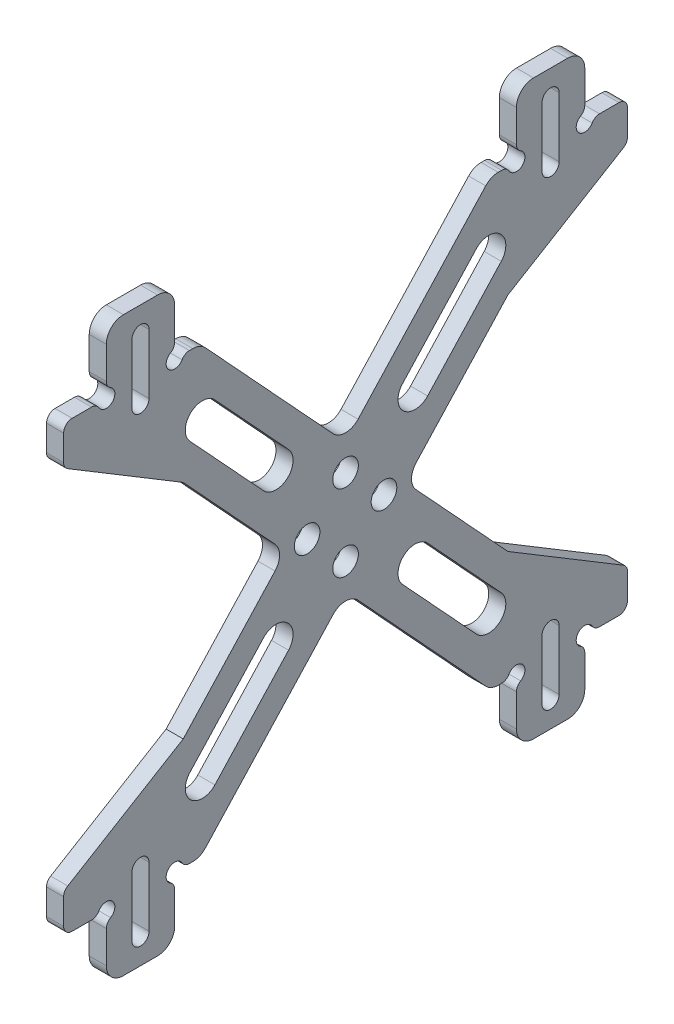
from build123d import *

# Parameters (mm, degrees)
SKETCH_1_W               = 74
SKETCH_1_H               = 52
EXTRUDE_1_DEPTH          = 2
CUT_EXTRUDE_2_DEPTH      = 10
SKETCH_3_W               = 2
SKETCH_3_H               = 8
EXTRUDE_3_DEPTH          = 7.5
FILLET_1_R               = 2
FILLET_1_OF_MIRROR_3_R   = 2
MIRROR_4_DEPTH           = 2
EXTRUDE_4_DEPTH          = 2
FILLET_3_R               = 1
FILLET_4_R               = 2
SKETCH_4_R               = 1.5
CUT_EXTRUDE_3_DEPTH      = 6
SKETCH_5_R               = 1
CUT_EXTRUDE_5_DEPTH      = 6
MIRROR_6_COPY_1_SKETCH_R = 1
MIRROR_6_COPY_1_DEPTH    = 6
SKETCH_6_R               = 1
CUT_EXTRUDE_6_DEPTH      = 10
MIRROR_9_COPY_1_SKETCH_R = 1
MIRROR_9_COPY_1_DEPTH    = 10
FILLET_5_R               = 1
CUT_EXTRUDE_7_DEPTH      = 10
MIRROR_12_COPY_1_DEPTH   = 10


# Read off the part's stored shape, not the designer's step: 镜向4
with BuildPart() as part:
    # 草图1 → 凸台-拉伸1 (new body)
    with BuildSketch(Plane(origin=(0, 0, 0), x_dir=(0, 0, -1), z_dir=(1, 0, 0))):
        Rectangle(SKETCH_1_W, SKETCH_1_H)
    extrude(amount=EXTRUDE_1_DEPTH)

    # 草图2 → 切除-拉伸2 (cut)
    with BuildSketch(Plane(origin=(2, 0, 0), x_dir=(0, 0, -1), z_dir=(1, 0, 0))):
        Polygon((-7, 0), (-31, 26), (-37, 26), (-37, -26), (-31, -26), align=None)
        Polygon((17, 26), (-17, 26), (0, 7.583333333), align=None)
        Polygon((31, 26), (7, 0), (31, -26), (37, -26), (37, 26), align=None)
        Polygon((17, -26), (0, -7.583333333), (-17, -26), align=None)
    extrude(amount=-CUT_EXTRUDE_2_DEPTH, mode=Mode.SUBTRACT)

    # 草图3 → 凸台-拉伸3 (add)
    with BuildSketch(Plane(origin=(0, 26, 0), x_dir=(1, 0, 0), z_dir=(0, 1, 0))):
        with Locations((1, -24)):
            Rectangle(SKETCH_3_W, SKETCH_3_H)
    extrude_3 = extrude(amount=EXTRUDE_3_DEPTH)

    # 圆角1
    fillet_1_edges = [part.edges().sort_by_distance(p)[0] for p in [
        (1, 33.5, 28),
        (1, 33.5, 20),
    ]]
    fillet(fillet_1_edges, radius=FILLET_1_R)

    # 镜向3: 凸台-拉伸3 across plane
    add(extrude_3.mirror(Plane.XY))

    # 圆角1 of 镜向3
    fillet_1_of_mirror_3_edges = [part.edges().sort_by_distance(p)[0] for p in [
        (1, 33.5, -28),
        (1, 33.5, -20),
    ]]
    fillet(fillet_1_of_mirror_3_edges, radius=FILLET_1_OF_MIRROR_3_R)

    # 镜向4 outline → 镜向4 (add)
    with BuildSketch(Plane.YZ):
        with BuildLine():
            Line((-26, 20), (-26, 28))
            Line((-26, 28), (-31.5, 28))
            ThreePointArc((-31.5, 28), (-32.914213562, 27.414213562), (-33.5, 26))
            Line((-33.5, 26), (-33.5, 22))
            ThreePointArc((-33.5, 22), (-32.914213562, 20.585786438), (-31.5, 20))
            Line((-31.5, 20), (-26, 20))
        make_face()
        with BuildLine():
            Line((-26, -20), (-31.5, -20))
            ThreePointArc((-31.5, -20), (-32.914213562, -20.585786438), (-33.5, -22))
            Line((-33.5, -22), (-33.5, -26))
            ThreePointArc((-33.5, -26), (-32.914213562, -27.414213562), (-31.5, -28))
            Line((-31.5, -28), (-26, -28))
            Line((-26, -28), (-26, -20))
        make_face()
    extrude(amount=MIRROR_4_DEPTH)

    # 草图7 → 凸台-拉伸4 (add)
    with BuildSketch(Plane(origin=(2, 0, 0), x_dir=(0, 0, -1), z_dir=(1, 0, 0))):
        Polygon((-28, 26), (-33, 26), (-33, 21.44166802), (-19, 13), align=None)
        Polygon((19, 13), (28, 26), (33, 26), (33, 21.44166802), align=None)
        Polygon((28, -26), (33, -26), (33, -21.44166802), (19, -13), align=None)
        Polygon((-19, -13), (-28, -26), (-33, -26), (-33, -21.44166802), align=None)
    extrude(amount=-EXTRUDE_4_DEPTH)

    # 圆角3
    fillet_3_edges = [part.edges().sort_by_distance(p)[0] for p in [
        (1, 26, 33),
        (1, 21.44166802, 33),
        (1, 26, -33),
        (1, 21.44166802, -33),
        (1, -26, -33),
        (1, -21.44166802, -33),
        (1, -26, 33),
        (1, -21.44166802, 33),
    ]]
    fillet(fillet_3_edges, radius=FILLET_3_R)

    # 圆角4
    fillet_4_edges = [part.edges().sort_by_distance(p)[0] for p in [
        (1, 0, -7),
        (1, 26, -17),
        (1, 7.583333333, 0),
        (1, 26, 17),
        (1, -7.583333333, 0),
        (1, -26, -17),
        (1, -26, 17),
        (1, 0, 7),
    ]]
    fillet(fillet_4_edges, radius=FILLET_4_R)

    # 草图4 → 切除-拉伸3 (cut)
    with BuildSketch(Plane(origin=(2, 0, 0), x_dir=(0, 0, -1), z_dir=(1, 0, 0))):
        with Locations((0, -4.5)):
            Circle(SKETCH_4_R)
        with Locations((-4.5, 0)):
            Circle(SKETCH_4_R)
        with Locations((0, 4.5)):
            Circle(SKETCH_4_R)
        with Locations((4.5, 0)):
            Circle(SKETCH_4_R)
    extrude(amount=-CUT_EXTRUDE_3_DEPTH, mode=Mode.SUBTRACT)

    # 草图5 → 切除-拉伸5 (cut)
    with BuildSketch(Plane(origin=(2, 0, 0), x_dir=(0, 0, -1), z_dir=(1, 0, 0))):
        with Locations((-24, 30.5)):
            Circle(SKETCH_5_R)
        with BuildLine():
            ThreePointArc((-23, 30.5), (-24, 29.5), (-25, 30.5))
            Line((-25, 30.5), (-25, 23.5))
            ThreePointArc((-25, 23.5), (-24, 24.5), (-23, 23.5))
            Line((-23, 23.5), (-23, 30.5))
        make_face()
        with Locations((-24, 23.5)):
            Circle(SKETCH_5_R)
    cut_extrude_5 = extrude(amount=-CUT_EXTRUDE_5_DEPTH, mode=Mode.SUBTRACT)

    # 镜向5: 切除-拉伸5 across plane
    add(cut_extrude_5.mirror(Plane.XY), mode=Mode.SUBTRACT)

    # 镜向6: 切除-拉伸5 across plane
    add(cut_extrude_5.mirror(Plane.ZX), mode=Mode.SUBTRACT)

    # 镜向6 copy 1 sketch → 镜向6 copy 1 (cut)
    with BuildSketch(Plane(origin=(2, 0, 0), x_dir=(0, 0, 1), z_dir=(1, 0, 0))):
        with Locations((-24, 30.5)):
            Circle(MIRROR_6_COPY_1_SKETCH_R)
        with BuildLine():
            ThreePointArc((-23, 30.5), (-24, 29.5), (-25, 30.5))
            Line((-25, 30.5), (-25, 23.5))
            ThreePointArc((-25, 23.5), (-24, 24.5), (-23, 23.5))
            Line((-23, 23.5), (-23, 30.5))
        make_face()
        with Locations((-24, 23.5)):
            Circle(MIRROR_6_COPY_1_SKETCH_R)
    extrude(amount=-MIRROR_6_COPY_1_DEPTH, mode=Mode.SUBTRACT)

    # 草图6 → 切除-拉伸6 (cut)
    with BuildSketch(Plane(origin=(2, 0, 0), x_dir=(0, 0, -1), z_dir=(1, 0, 0))):
        with Locations((-20, 26)):
            Circle(SKETCH_6_R)
        with Locations((-28, 26)):
            Circle(SKETCH_6_R)
    cut_extrude_6 = extrude(amount=-CUT_EXTRUDE_6_DEPTH, mode=Mode.SUBTRACT)

    # 镜向8: 切除-拉伸6 across plane
    add(cut_extrude_6.mirror(Plane.ZX), mode=Mode.SUBTRACT)

    # 镜向9: 切除-拉伸6 across plane
    add(cut_extrude_6.mirror(Plane.XY), mode=Mode.SUBTRACT)

    # 镜向9 copy 1 sketch → 镜向9 copy 1 (cut)
    with BuildSketch(Plane(origin=(2, 0, 0), x_dir=(0, 0, 1), z_dir=(1, 0, 0))):
        with Locations((-20, 26)):
            Circle(MIRROR_9_COPY_1_SKETCH_R)
        with Locations((-28, 26)):
            Circle(MIRROR_9_COPY_1_SKETCH_R)
    extrude(amount=-MIRROR_9_COPY_1_DEPTH, mode=Mode.SUBTRACT)

    # 圆角5
    fillet_5_edges = [part.edges().sort_by_distance(p)[0] for p in [
        (1, 27, 20),
        (1, 27, 28),
        (1, 26, 19),
        (1, 26, 29),
        (1, -27, 28),
        (1, -27, 20),
        (1, -26, 19),
        (1, -26, 29),
        (1, -27, -20),
        (1, -27, -28),
        (1, -26, -19),
        (1, -26, -29),
        (1, 27, -28),
        (1, 27, -20),
        (1, 26, -19),
        (1, 26, -29),
    ]]
    fillet(fillet_5_edges, radius=FILLET_5_R)

    # 草图8 → 切除-拉伸7 (cut)
    with BuildSketch(Plane(origin=(2, 0, 0), x_dir=(0, 0, -1), z_dir=(1, 0, 0))):
        with BuildLine():
            Line((-15.289196292, 19.511930318), (-6.669754344, 10.174201541))
            ThreePointArc((-6.669754344, 10.174201541), (-6.782801027, 7.348034446), (-9.608968122, 7.46108113))
            Line((-9.608968122, 7.46108113), (-18.22841007, 16.798809907))
            ThreePointArc((-18.22841007, 16.798809907), (-18.115363387, 19.624977002), (-15.289196292, 19.511930318))
        make_face()
    cut_extrude_7 = extrude(amount=-CUT_EXTRUDE_7_DEPTH, mode=Mode.SUBTRACT)

    # 镜向11: 切除-拉伸7 across plane
    add(cut_extrude_7.mirror(Plane.XY), mode=Mode.SUBTRACT)

    # 镜向12: 切除-拉伸7 across plane
    add(cut_extrude_7.mirror(Plane.ZX), mode=Mode.SUBTRACT)

    # 镜向12 copy 1 sketch → 镜向12 copy 1 (cut)
    with BuildSketch(Plane(origin=(2, 0, 0), x_dir=(0, 0, 1), z_dir=(1, 0, 0))):
        with BuildLine():
            Line((-15.289196292, 19.511930318), (-6.669754344, 10.174201541))
            ThreePointArc((-6.669754344, 10.174201541), (-6.782801027, 7.348034446), (-9.608968122, 7.46108113))
            Line((-9.608968122, 7.46108113), (-18.22841007, 16.798809907))
            ThreePointArc((-18.22841007, 16.798809907), (-18.115363387, 19.624977002), (-15.289196292, 19.511930318))
        make_face()
    extrude(amount=-MIRROR_12_COPY_1_DEPTH, mode=Mode.SUBTRACT)


solid = part.part
